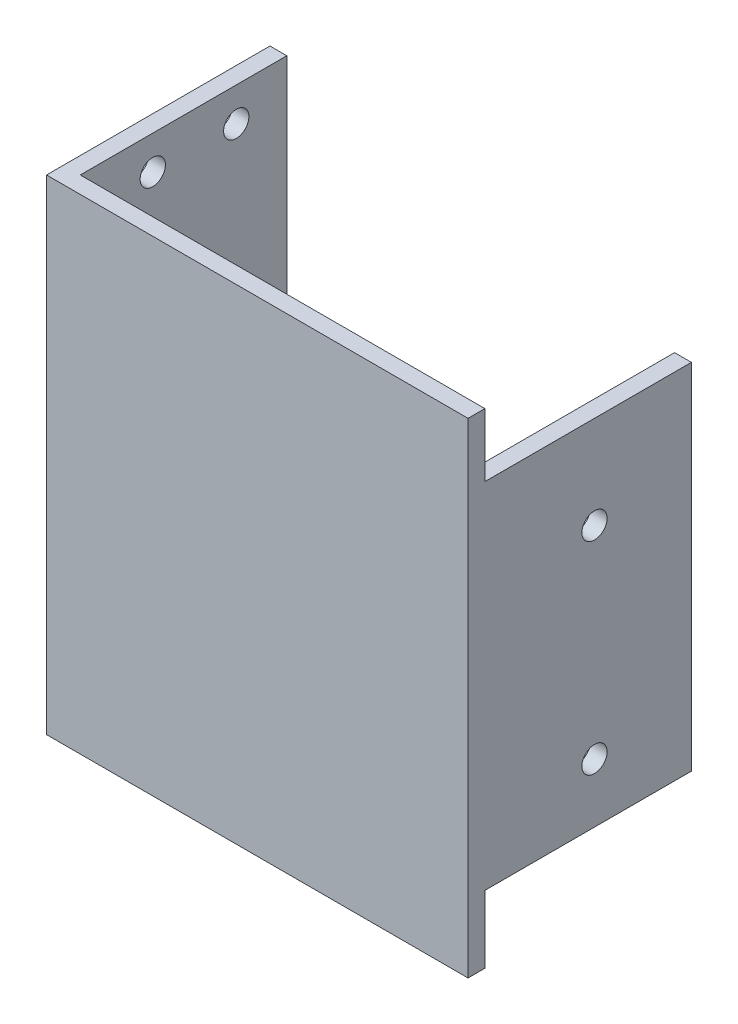
from build123d import *

# Parameters (mm, degrees)
SKETCH_1_W               = 40
SKETCH_1_H               = 75
EXTRUDE_1_DEPTH          = 21
FILLET_1_R               = 20
CHAMFER_1_SIZE           = 10
EXTRUDE_2_DEPTH          = 700
SKETCH_3_R               = 19
EXTRUDE_4_DEPTH          = 74
SKETCH_4_W               = 17
SKETCH_4_H               = 17
EXTRUDE_5_DEPTH          = 19
SKETCH_5_R               = 3
CUT_EXTRUDE_1_DEPTH      = 19
SKETCH_6_R               = 10
EXTRUDE_6_DEPTH          = 16.5
SKETCH_7_R               = 20
EXTRUDE_7_DEPTH          = 20
SKETCH_8_W               = 50
SKETCH_8_H               = 57.5
EXTRUDE_8_DEPTH          = 2
SKETCH_9_W               = 2
SKETCH_9_H               = 57.5
EXTRUDE_9_DEPTH          = 24.5
SKETCH_10_W              = 2
SKETCH_10_H              = 42
EXTRUDE_10_DEPTH         = 24.5
SKETCH_11_R              = 1.5
CUT_EXTRUDE_2_DEPTH      = 10
SKETCH_12_R              = 1.5
CUT_EXTRUDE_3_DEPTH      = 10
SKETCH_13_R              = 1.5
CUT_EXTRUDE_4_DEPTH      = 10
CUT_EXTRUDE_5_DEPTH      = 767.033982601
CUT_EXTRUDE_5_DEPTH_BACK = 767.033982601
SKETCH_14_W              = 811.309857384
SKETCH_14_H              = 283.720617643


with BuildPart() as part:
    # 草图1 → 凸台-拉伸1 (new body)
    with BuildSketch(Plane.XY):
        Rectangle(SKETCH_1_W, SKETCH_1_H)
    extrude(amount=EXTRUDE_1_DEPTH)

    # 圆角1
    fillet_1_edges = [part.edges().sort_by_distance(p)[0] for p in [
        (-20, 37.5, 10.5),
        (20, 37.5, 10.5),
    ]]
    fillet(fillet_1_edges, radius=FILLET_1_R - 0.0001)  # a hair under: the kernel refuses the full size

    # 倒角1
    chamfer_1_edges = [part.edges().sort_by_distance(p)[0] for p in [
        (20, -37.5, 10.5),
        (-20, -37.5, 10.5),
    ]]
    chamfer(chamfer_1_edges, length=CHAMFER_1_SIZE)

    # 草图2 → 凸台-拉伸2 (add)
    with BuildSketch(Plane(origin=(0, 0, 0), x_dir=(-1, 0, 0), z_dir=(0, 0, -1))):
        with BuildLine():
            Line((-10, -37.5), (10, -37.5))
            Line((10, -37.5), (14.449874371, -21.525062814))
            ThreePointArc((14.449874371, -21.525062814), (0, -2.5), (-14.449874371, -21.525062814))
            Line((-14.449874371, -21.525062814), (-10, -37.5))
        make_face()
    extrude(amount=EXTRUDE_2_DEPTH)

    # 草图3 → 凸台-拉伸4 (add)
    with BuildSketch(Plane(origin=(0, 0, 0), x_dir=(-1, 0, 0), z_dir=(0, 0, -1))):
        with Locations(Location((0, 17.5, 0), (0, 0, 180))):
            Circle(SKETCH_3_R)
    extrude(amount=EXTRUDE_4_DEPTH)

    # 草图4 → 凸台-拉伸5 (add)
    with BuildSketch(Plane.XY.offset(21)):
        with Locations((0, -16.5)):
            Rectangle(SKETCH_4_W, SKETCH_4_H)
    extrude(amount=EXTRUDE_5_DEPTH)

    # 草图5 → 切除-拉伸1 (cut)
    with BuildSketch(Plane.ZY.offset(8.5)):
        with Locations(Location((31.5, -16.5, 0), (0, 0, 270))):
            Circle(SKETCH_5_R)
    extrude(amount=-CUT_EXTRUDE_1_DEPTH, mode=Mode.SUBTRACT)

    # 草图6 → 凸台-拉伸6 (add)
    with BuildSketch(Plane(origin=(0, 0, -700), x_dir=(-1, 0, 0), z_dir=(0, 0, -1))):
        with Locations((0, -17.5)):
            Circle(SKETCH_6_R)
    extrude(amount=EXTRUDE_6_DEPTH)

    # 草图7 → 凸台-拉伸7 (add)
    with BuildSketch(Plane(origin=(0, 0, -716.5), x_dir=(-1, 0, 0), z_dir=(0, 0, -1))):
        with Locations((0, -17.5)):
            Circle(SKETCH_7_R)
    extrude(amount=EXTRUDE_7_DEPTH)

    # 草图8 → 凸台-拉伸8 (add)
    with BuildSketch(Plane(origin=(0, 0, -736.5), x_dir=(-1, 0, 0), z_dir=(0, 0, -1))):
        with Locations((0, -17.5)):
            Rectangle(SKETCH_8_W, SKETCH_8_H)
    extrude(amount=EXTRUDE_8_DEPTH)

    # 草图9 → 凸台-拉伸9 (add)
    with BuildSketch(Plane(origin=(0, 0, -738.5), x_dir=(-1, 0, 0), z_dir=(0, 0, -1))):
        with Locations((24, -17.5)):
            Rectangle(SKETCH_9_W, SKETCH_9_H)
    extrude(amount=EXTRUDE_9_DEPTH)

    # 草图10 → 凸台-拉伸10 (add)
    with BuildSketch(Plane(origin=(0, 0, -738.5), x_dir=(-1, 0, 0), z_dir=(0, 0, -1))):
        with Locations((-24, -17.25)):
            Rectangle(SKETCH_10_W, SKETCH_10_H)
    extrude(amount=EXTRUDE_10_DEPTH)

    # 草图11 → 切除-拉伸2 (cut)
    with BuildSketch(Plane.ZY.offset(25)):
        with Locations(Location((-757, 7.25, 0), (0, 0, 270))):
            Circle(SKETCH_11_R)
        with Locations(Location((-747.1, 7.25, 0), (0, 0, 270))):
            Circle(SKETCH_11_R)
        with Locations(Location((-747.1, -41.75, 0), (0, 0, 270))):
            Circle(SKETCH_11_R)
        with Locations(Location((-757, -41.75, 0), (0, 0, 270))):
            Circle(SKETCH_11_R)
    extrude(amount=-CUT_EXTRUDE_2_DEPTH, mode=Mode.SUBTRACT)

    # 草图12 → 切除-拉伸3 (cut)
    with BuildSketch(Plane.ZY.offset(25)):
        with Locations(Location((-752.05, -31.25, 0), (0, 0, 270))):
            Circle(SKETCH_12_R)
    extrude(amount=-CUT_EXTRUDE_3_DEPTH, mode=Mode.SUBTRACT)

    # 草图13 → 切除-拉伸4 (cut)
    with BuildSketch(Plane(origin=(25, 0, 0), x_dir=(0, 0, -1), z_dir=(1, 0, 0))):
        with Locations(Location((751.5, -7.25, 0), (0, 0, 90))):
            Circle(SKETCH_13_R)
        with Locations(Location((751.5, -31.25, 0), (0, 0, 90))):
            Circle(SKETCH_13_R)
    extrude(amount=-CUT_EXTRUDE_4_DEPTH, mode=Mode.SUBTRACT)

    # 草图14 → 切除-拉伸5 (cut, two sides: drawn at the far end of the back side and taken through both)
    with BuildSketch(Plane.ZY.offset(25).offset(-CUT_EXTRUDE_5_DEPTH_BACK)):
        with Locations((-330.845071308, -36.311792758)):
            Rectangle(SKETCH_14_W, SKETCH_14_H)
    extrude(amount=CUT_EXTRUDE_5_DEPTH + CUT_EXTRUDE_5_DEPTH_BACK, mode=Mode.SUBTRACT)


solid = part.part
